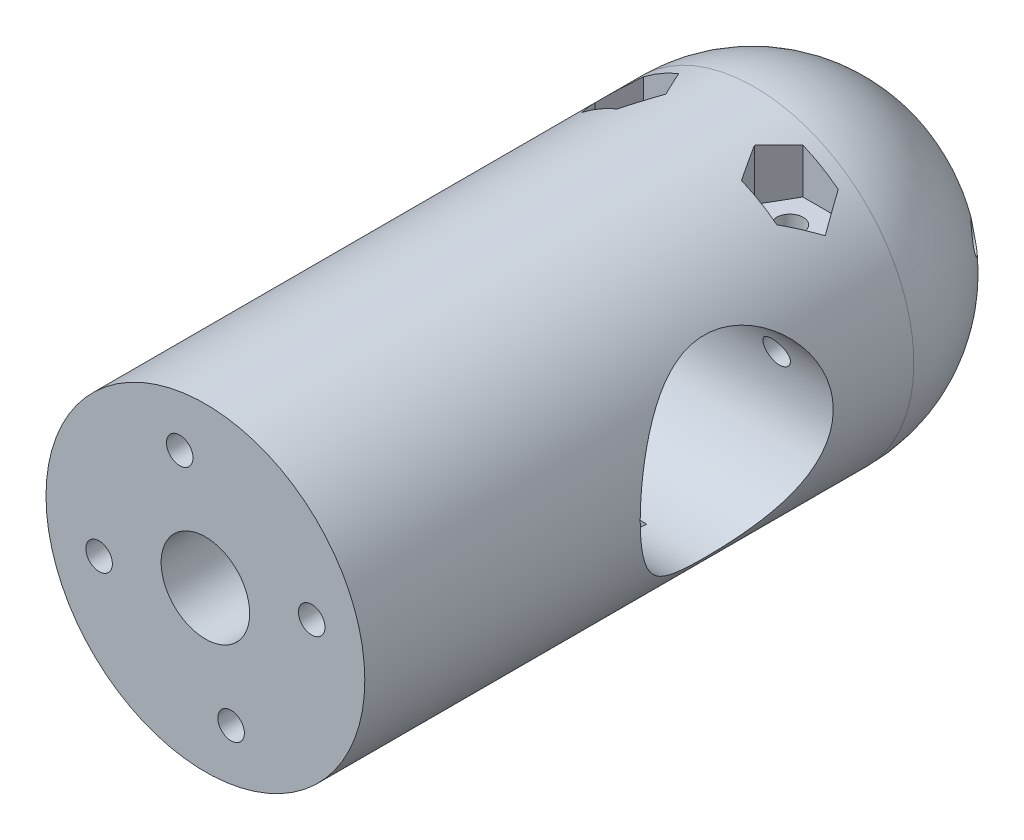
from build123d import *

# Parameters (mm, degrees)
SKETCH1_R               = 18
BOSS_EXTRUDE1_DEPTH     = 62
BOSS_EXTRUDE2_START     = 17.5
SKETCH10_R              = 18
BOSS_EXTRUDE2_DEPTH     = 17.5
FILLET1_R               = 17.5
CUT_EXTRUDE1_DEPTH      = 68.02238432
CUT_EXTRUDE1_DEPTH_BACK = 68.02238432
SKETCH3_R               = 10.9
SKETCH4_R               = 1.5
CUT_EXTRUDE3_DEPTH      = 84.476044511
CUT_EXTRUDE7_START      = 17.5
CUT_EXTRUDE7_DEPTH      = 6
CUT_EXTRUDE8_DEPTH      = 74.676658604
CUT_EXTRUDE8_DEPTH_BACK = 74.676658604
SKETCH6_R               = 1.5
SKETCH7_R               = 4.05
CUT_EXTRUDE9_DEPTH      = 6
CUT_EXTRUDE10_START     = -15
SKETCH8_R               = 5
CUT_EXTRUDE10_DEPTH     = 27.063804338
SKETCH9_R               = 5
CUT_EXTRUDE11_DEPTH     = 10


with BuildPart() as part:
    # Sketch1 → Boss-Extrude1 (new body)
    with BuildSketch(Plane.XY):
        Circle(SKETCH1_R)
    extrude(amount=BOSS_EXTRUDE1_DEPTH)

    # Sketch10 → Boss-Extrude2 (add)
    with BuildSketch(Plane(origin=(0, 0, 0), x_dir=(-1, 0, 0), z_dir=(0, 0, -1)).offset(BOSS_EXTRUDE2_START)):
        Circle(SKETCH10_R)
    extrude(amount=-BOSS_EXTRUDE2_DEPTH)

    # Fillet1
    fillet1_edges = [part.edges().sort_by_distance(p)[0] for p in [
        (18, 0, -17.5),
    ]]
    fillet(fillet1_edges, radius=FILLET1_R - 0.0001)  # a hair under: the kernel refuses the full size

    # Sketch3 → Cut-Extrude1 (cut, two sides: drawn at the far end of the back side and taken through both)
    with BuildSketch(Plane(origin=(0, 0, 0), x_dir=(0, 0, -1), z_dir=(1, 0, 0)).offset(-CUT_EXTRUDE1_DEPTH_BACK)):
        with Locations((-20, 0)):
            Circle(SKETCH3_R)
    extrude(amount=CUT_EXTRUDE1_DEPTH + CUT_EXTRUDE1_DEPTH_BACK, mode=Mode.SUBTRACT)

    # Sketch4 → Cut-Extrude3 (cut, through all)
    with BuildSketch(Plane.XY.offset(62)):
        with Locations((12.004686585, 2.9)):
            Circle(SKETCH4_R)
        with Locations((2.9, -12.004686585)):
            Circle(SKETCH4_R)
        with Locations((-12.004686585, -2.9)):
            Circle(SKETCH4_R)
        with Locations((-2.9, 12.004686585)):
            Circle(SKETCH4_R)
    extrude(amount=-CUT_EXTRUDE3_DEPTH, mode=Mode.SUBTRACT)

    # Sketch5 → Cut-Extrude7 (cut)
    with BuildSketch(Plane(origin=(0, 0, 0), x_dir=(1, 0, 0), z_dir=(0, 1, 0)).offset(CUT_EXTRUDE7_START)):
        Polygon((5, -5), (7, -8.464101615), (11, -8.464101615), (13, -5), (11, -1.535898385), (7, -1.535898385), align=None)
        Polygon((-7, -1.535898385), (-5, -5), (-7, -8.464101615), (-11, -8.464101615), (-13, -5), (-11, -1.535898385), align=None)
    extrude(amount=-CUT_EXTRUDE7_DEPTH, mode=Mode.SUBTRACT)

    # Sketch6 → Cut-Extrude8 (cut, two sides: drawn at the far end of the back side and taken through both)
    with BuildSketch(Plane(origin=(0, -17.5, 0), x_dir=(-1, 0, 0), z_dir=(0, -1, 0)).offset(-CUT_EXTRUDE8_DEPTH_BACK)):
        with Locations(Location((-9, -5, 0), (0, 0, 180))):
            Circle(SKETCH6_R)
        with Locations(Location((9, -5, 0), (0, 0, 180))):
            Circle(SKETCH6_R)
    extrude(amount=CUT_EXTRUDE8_DEPTH + CUT_EXTRUDE8_DEPTH_BACK, mode=Mode.SUBTRACT)

    # Sketch7 → Cut-Extrude9 (cut)
    with BuildSketch(Plane(origin=(0, -17.5, 0), x_dir=(-1, 0, 0), z_dir=(0, -1, 0))):
        with Locations(Location((-9, -5, 0), (0, 0, 180))):
            Circle(SKETCH7_R)
        with Locations(Location((9, -5, 0), (0, 0, 180))):
            Circle(SKETCH7_R)
    extrude(amount=-CUT_EXTRUDE9_DEPTH, mode=Mode.SUBTRACT)

    # Sketch8 → Cut-Extrude10 (cut)
    with BuildSketch(Plane.XY.offset(62).offset(CUT_EXTRUDE10_START)):
        with Locations((2.9, -12.004686585)):
            Circle(SKETCH8_R)
        with Locations((-12.004686585, -2.9)):
            Circle(SKETCH8_R)
        with Locations((-2.9, 12.004686585)):
            Circle(SKETCH8_R)
        with Locations((12.004686585, 2.9)):
            Circle(SKETCH8_R)
    extrude(amount=-CUT_EXTRUDE10_DEPTH, mode=Mode.SUBTRACT)

    # Sketch9 → Cut-Extrude11 (cut)
    with BuildSketch(Plane.XY.offset(62)):
        Circle(SKETCH9_R)
    extrude(amount=-CUT_EXTRUDE11_DEPTH, mode=Mode.SUBTRACT)


solid = part.part
